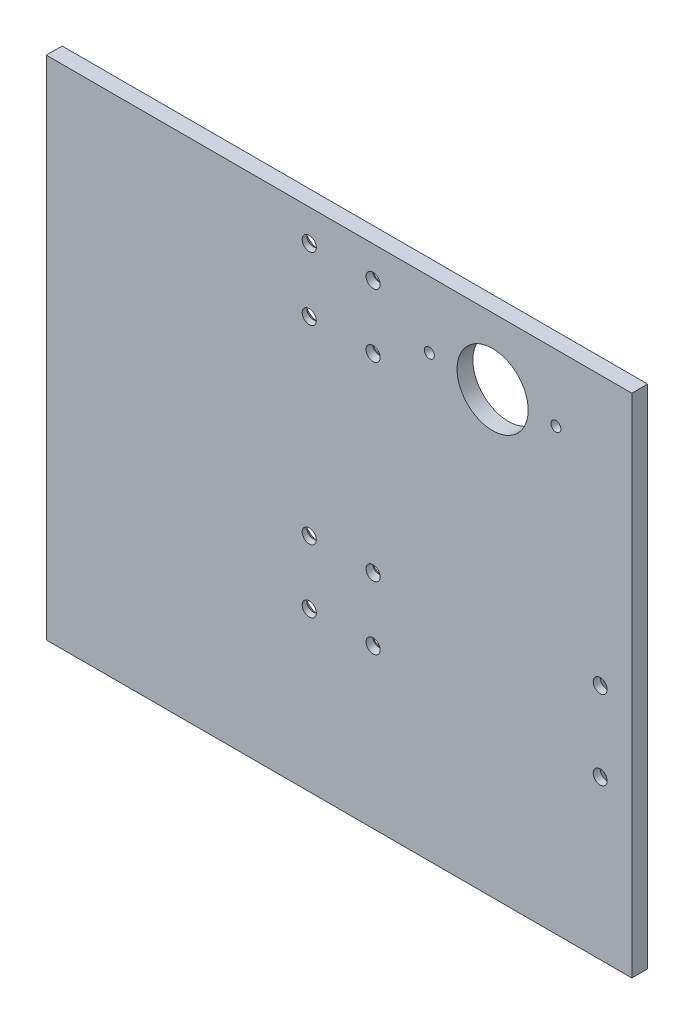
from build123d import *

# Parameters (mm, degrees)
SKETCH1_W                                          = 234.95
SKETCH1_H                                          = 203.2
BOSS_EXTRUDE1_DEPTH                                = 6.35
SKETCH2_R                                          = 14.2748
CUT_EXTRUDE1_DEPTH                                 = 156.445354144
CSK_FOR_10_FLAT_HEAD_MACHINE_SCREW_100_D           = 5.6134
CSK_FOR_10_FLAT_HEAD_MACHINE_SCREW_100_CSINK_D     = 17.78
CSK_FOR_10_FLAT_HEAD_MACHINE_SCREW_100_CSINK_ANGLE = 90
CSK_FOR_10_FLAT_HEAD_MACHINE_SCREW_2_D             = 5.6134
CSK_FOR_10_FLAT_HEAD_MACHINE_SCREW_2_CSINK_D       = 17.78
CSK_FOR_10_FLAT_HEAD_MACHINE_SCREW_2_CSINK_ANGLE   = 90
CSK_FOR_10_FLAT_HEAD_MACHINE_SCREW_3_D             = 5.6134
CSK_FOR_10_FLAT_HEAD_MACHINE_SCREW_3_DEPTH         = 23.972796233
CSK_FOR_10_FLAT_HEAD_MACHINE_SCREW_3_CSINK_D       = 12.7
CSK_FOR_10_FLAT_HEAD_MACHINE_SCREW_3_CSINK_ANGLE   = 90
CSK_FOR_10_FLAT_HEAD_MACHINE_SCREW_3_TIP           = 1.686435499
CUT_EXTRUDE2_DEPTH                                 = 156.445354144


with BuildPart() as part:
    # Sketch1 → Boss-Extrude1 (new body)
    with BuildSketch(Plane.XY):
        Rectangle(SKETCH1_W, SKETCH1_H)
    extrude(amount=BOSS_EXTRUDE1_DEPTH)

    # Sketch2 → Cut-Extrude1 (cut, through all)
    with BuildSketch(Plane.XY.offset(6.35)):
        with Locations((61.595, 74.93)):
            Circle(SKETCH2_R)
    extrude(amount=-CUT_EXTRUDE1_DEPTH, mode=Mode.SUBTRACT)

    # CSK for _10 Flat Head Machine Screw _100 (through all)
    with Locations(Plane(origin=(292.076985897, -265.595089466, -43.80037576), x_dir=(0.9908610866457157, 0, -0.1348862742137668), z_dir=(-0.1348862742137668, 0, -0.9908610866457157))):
        with Locations((-308.041854918, -227.495089466), (-308.041854918, -252.895089466), (-308.041972913, -329.095089466), (-308.041972913, -354.495089466)):
            CounterSinkHole(CSK_FOR_10_FLAT_HEAD_MACHINE_SCREW_100_D / 2, CSK_FOR_10_FLAT_HEAD_MACHINE_SCREW_100_CSINK_D / 2, counter_sink_angle=CSK_FOR_10_FLAT_HEAD_MACHINE_SCREW_100_CSINK_ANGLE)

    # CSK for _10 Flat Head Machine Screw  2 (through all)
    with Locations(Plane(origin=(292.419597033, -265.595089466, -41.283588599), x_dir=(0.9908610866457157, 0, -0.13488627421376656), z_dir=(-0.13488627421376656, 0, -0.9908610866457157))):
        with Locations((-282.641854918, -227.495089466), (-282.641854918, -252.895089466), (-282.641972913, -329.095089466), (-282.641972913, -354.495089466)):
            CounterSinkHole(CSK_FOR_10_FLAT_HEAD_MACHINE_SCREW_2_D / 2, CSK_FOR_10_FLAT_HEAD_MACHINE_SCREW_2_CSINK_D / 2, counter_sink_angle=CSK_FOR_10_FLAT_HEAD_MACHINE_SCREW_2_CSINK_ANGLE)

    # CSK for _10 Flat Head Machine Screw  3
    with Locations(Plane(origin=(-285.488101876, 60.95524491, 0), x_dir=(-1, 0, 0), z_dir=(0, 0, -1))):
        with Locations((-390.263101876, -67.30524491), (-390.263101876, -99.05524491)):
            CounterSinkHole(CSK_FOR_10_FLAT_HEAD_MACHINE_SCREW_3_D / 2, CSK_FOR_10_FLAT_HEAD_MACHINE_SCREW_3_CSINK_D / 2, depth=CSK_FOR_10_FLAT_HEAD_MACHINE_SCREW_3_DEPTH, counter_sink_angle=CSK_FOR_10_FLAT_HEAD_MACHINE_SCREW_3_CSINK_ANGLE)
            with Locations((0, 0, -(CSK_FOR_10_FLAT_HEAD_MACHINE_SCREW_3_DEPTH + CSK_FOR_10_FLAT_HEAD_MACHINE_SCREW_3_TIP / 2))):  # 118° drill point
                Cone(0, CSK_FOR_10_FLAT_HEAD_MACHINE_SCREW_3_D / 2, CSK_FOR_10_FLAT_HEAD_MACHINE_SCREW_3_TIP, mode=Mode.SUBTRACT)

    # Sketch10 → Cut-Extrude2 (cut, through all)
    with BuildSketch(Plane(origin=(0, 0, 0), x_dir=(-1, 0, 0), z_dir=(0, 0, -1))):
        with BuildLine():
            ThreePointArc((-36.190611119, 72.966686968), (-34.175766597, 74.990432638), (-36.199512267, 77.005277159))
            ThreePointArc((-36.199512267, 77.005277159), (-38.214356788, 74.98153149), (-36.190611119, 72.966686968))
        make_face()
        with BuildLine():
            ThreePointArc((-86.990487733, 72.854722841), (-84.975643212, 74.87846851), (-86.999388881, 76.893313032))
            ThreePointArc((-86.999388881, 76.893313032), (-89.014233403, 74.869567362), (-86.990487733, 72.854722841))
        make_face()
    extrude(amount=-CUT_EXTRUDE2_DEPTH, mode=Mode.SUBTRACT)


solid = part.part
